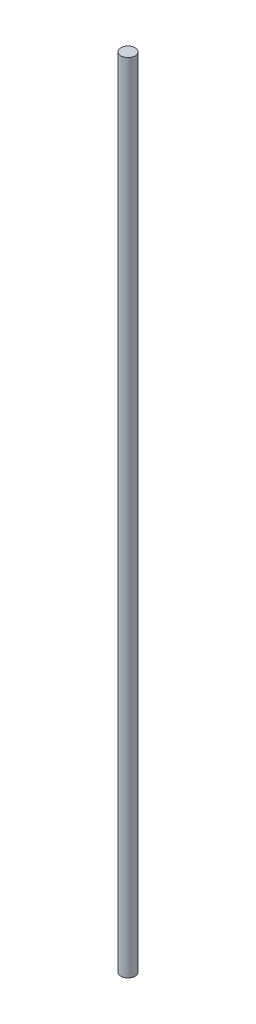
from build123d import *

# Parameters (mm, degrees)
SKETCH1_R           = 4
BOSS_EXTRUDE1_DEPTH = 450


with BuildPart() as part:
    # Sketch1 → Boss-Extrude1 (new body)
    with BuildSketch(Plane(origin=(0, 0, 0), x_dir=(1, 0, 0), z_dir=(0, 1, 0))):
        Circle(SKETCH1_R)
    extrude(amount=BOSS_EXTRUDE1_DEPTH)


solid = part.part
